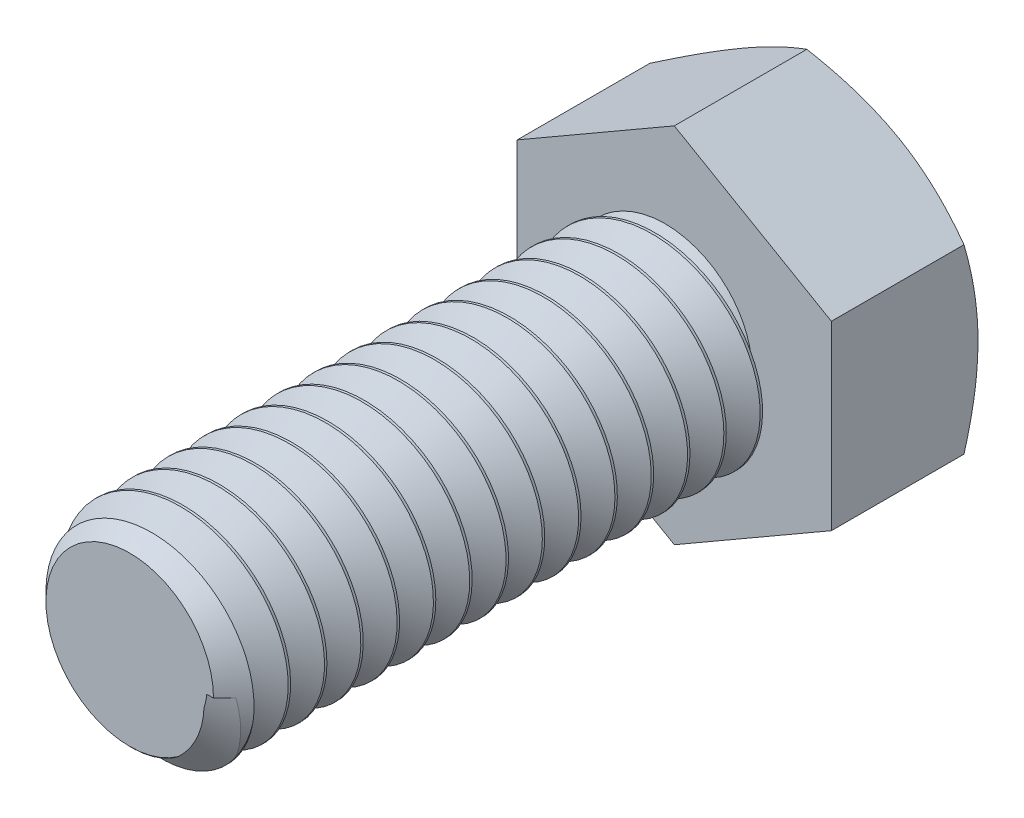
from build123d import *

# Parameters (mm, degrees)
BOSS_EXTRUDE1_DEPTH = 7
SKETCH2_OUTSIDE_W   = 39.112
SKETCH2_OUTSIDE_H   = 41.432
SKETCH2_OUTSIDE_R   = 7.5
CUT_EXTRUDE2_DEPTH  = 5
CUT_EXTRUDE2_DRAFT  = -60
SKETCH3_R           = 5
BOSS_EXTRUDE2_DEPTH = 26
CHAMFER1_SIZE       = 1
CUT_SWEEP1_PITCH    = 1.733333333
CUT_SWEEP1_TO       = 26


with BuildPart() as part:
    # Sketch1 → Boss-Extrude1 (new body)
    with BuildSketch(Plane.XY):
        Polygon((7.5, -4.330127019), (7.5, 4.330127019), (0, 8.660254038), (-7.5, 4.330127019), (-7.5, -4.330127019), (0, -8.660254038), align=None)
    extrude(amount=BOSS_EXTRUDE1_DEPTH)


with BuildPart() as cut_extrude2_tool:
    # Sketch2 outside → Cut-Extrude2 (with draft: the straight prism first)
    with BuildSketch(Plane(origin=(0, 0, 0), x_dir=(-1, 0, 0), z_dir=(0, 0, -1))):
        Rectangle(SKETCH2_OUTSIDE_W, SKETCH2_OUTSIDE_H)
        Circle(SKETCH2_OUTSIDE_R, mode=Mode.SUBTRACT)
    extrude(amount=-CUT_EXTRUDE2_DEPTH)
    # Cut-Extrude2: the draft: its side faces are tilted about the plane it starts from
    cut_extrude2_sides = [cut_extrude2_tool.faces().sort_by_distance(p)[0] for p in [
        (0, -20.716, 2.5),
        (-19.556, 0, 2.5),
        (0, 20.716, 2.5),
        (19.556, 0, 2.5),
        (7.5, 0, 2.5),
    ]]
    draft(cut_extrude2_sides, Plane(origin=(0, 0, 0), x_dir=(-1, 0, 0), z_dir=(0, 0, -1)), CUT_EXTRUDE2_DRAFT)


with BuildPart() as part_1:
    add(part.part)

    # Cut-Extrude2: cut by cut_extrude2_tool
    add(cut_extrude2_tool.part, mode=Mode.SUBTRACT)

    # Sketch3 → Boss-Extrude2 (add)
    with BuildSketch(Plane.XY.offset(7)):
        with Locations(Location((0, 0, 0), (0, 0, 180))):
            Circle(SKETCH3_R)
    extrude(amount=BOSS_EXTRUDE2_DEPTH)

    # Chamfer1
    chamfer1_edges = [part_1.edges().sort_by_distance(p)[0] for p in [
        (5, 0, 33),
    ]]
    chamfer(chamfer1_edges, length=CHAMFER1_SIZE)

    # Cut-Sweep1: arcs per turn and ends read off the stored shape
    # Cut-Sweep1: the profile of Sketch5 screwed along a right-hand helix through 16 turns, 10 arcs to a turn; built about Z, then put on its axis
    cut_sweep1_z = Axis((0, 0, 0), (0, 0, 1))
    cut_sweep1_corners = [(5.742730405, 0, -1.186739881), (5.656381682, 0, 1.236593339), (3.600887913, 0, -0.049853458)]
    with BuildLine(mode=Mode.PRIVATE) as cut_sweep1_profile:
        Line(cut_sweep1_corners[0], cut_sweep1_corners[1])
        Line(cut_sweep1_corners[1], cut_sweep1_corners[2])
        Line(cut_sweep1_corners[2], cut_sweep1_corners[0])
    cut_sweep1_cap = Face(cut_sweep1_profile.wire())
    cut_sweep1_turn_angles = [0, 18, 36, 54, 72, 90, 108, 126, 144, 162, 180, 198, 216, 234, 252, 270, 288, 306, 324, 342, 360]
    cut_sweep1_turn_weights = [1, 0.9510565162951535, 1, 0.9510565162951535, 1, 0.9510565162951535, 1, 0.9510565162951535, 1, 0.9510565162951535, 1, 0.9510565162951535, 1, 0.9510565162951535, 1, 0.9510565162951535, 1, 0.9510565162951535, 1, 0.9510565162951535, 1]
    cut_sweep1_turn_rails = [Edge.make_bspline([Vector(p[0], p[1], 0).rotate(cut_sweep1_z, cut_sweep1_turn_angles[k]) / cut_sweep1_turn_weights[k] + Vector(0, 0, p[2] + CUT_SWEEP1_PITCH * cut_sweep1_turn_angles[k] / 360) for k in range(21)], [0, 0, 0, 1, 1, 2, 2, 3, 3, 4, 4, 5, 5, 6, 6, 7, 7, 8, 8, 9, 9, 10, 10, 10], 2, cut_sweep1_turn_weights) for p in cut_sweep1_corners]
    cut_sweep1_turn_sides = [Face.make_surface_from_curves(cut_sweep1_turn_rails[p[0]], cut_sweep1_turn_rails[p[1]]) for p in [(0, 1), (1, 2), (2, 0)]]
    cut_sweep1 = Plane(origin=(0, 0, 33), x_dir=(1, 0, 0), z_dir=(0, 0, -1)) * split(Solid(Shell([*[p.moved(Location((0, 0, CUT_SWEEP1_PITCH * i))) for i in range(16) for p in cut_sweep1_turn_sides], cut_sweep1_cap, cut_sweep1_cap.rotate(cut_sweep1_z, 5760).moved(Location((0, 0, CUT_SWEEP1_PITCH * 5760 / 360)))])), bisect_by=Plane.XY.offset(CUT_SWEEP1_TO), keep=Keep.BOTTOM, mode=Mode.PRIVATE)
    add(cut_sweep1, mode=Mode.SUBTRACT)


solid = part_1.part
